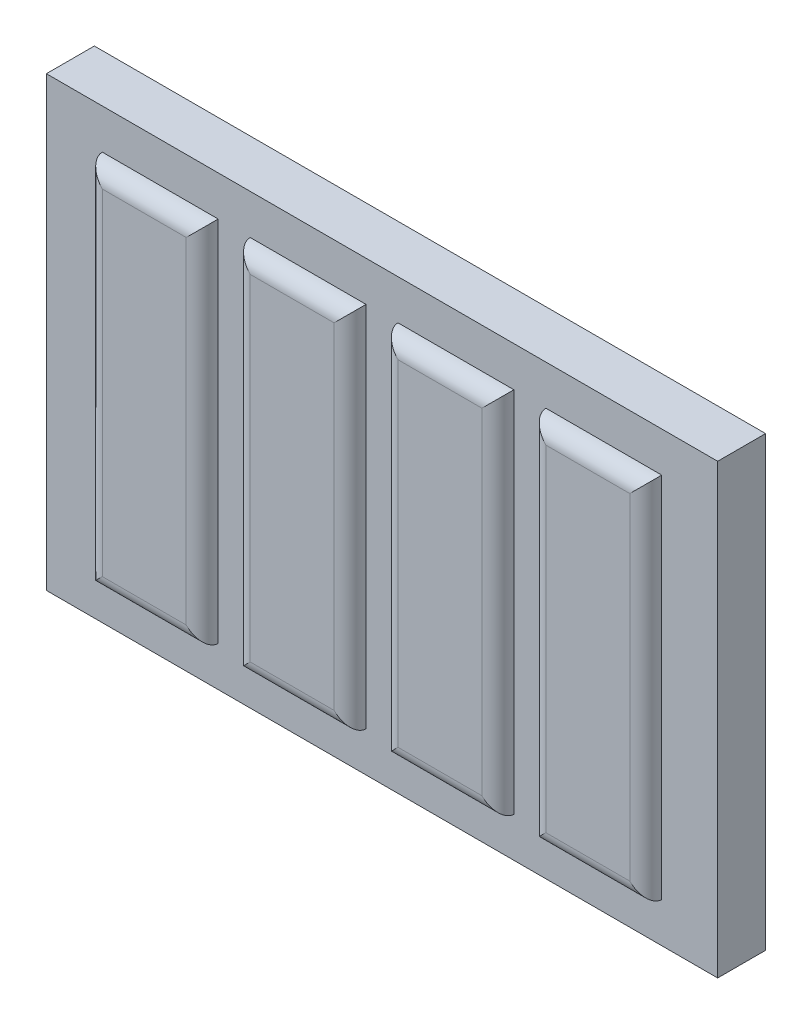
from build123d import *

# Parameters (mm, degrees)
SKETCH1_W           = 10.668
SKETCH1_H           = 7.112
BOSS_EXTRUDE1_DEPTH = 0.762
SKETCH2_W           = 1.8415
SKETCH2_H           = 5.842
BOSS_EXTRUDE2_DEPTH = 0.254
FILLET1_R           = 0.254


with BuildPart() as part:
    # Sketch1 → Boss-Extrude1 (new body)
    with BuildSketch(Plane.XY):
        with Locations((5.334, 3.556)):
            Rectangle(SKETCH1_W, SKETCH1_H)
    extrude(amount=BOSS_EXTRUDE1_DEPTH)

    # Sketch2 → Boss-Extrude2 (add)
    with BuildSketch(Plane.XY.offset(0.762)):
        with Locations((8.85825, 3.556)):
            Rectangle(SKETCH2_W, SKETCH2_H)
        with Locations((1.80975, 3.556)):
            Rectangle(SKETCH2_W, SKETCH2_H)
        with Locations((4.15925, 3.556)):
            Rectangle(SKETCH2_W, SKETCH2_H)
        with Locations((6.50875, 3.556)):
            Rectangle(SKETCH2_W, SKETCH2_H)
    extrude(amount=BOSS_EXTRUDE2_DEPTH)

    # Fillet1
    fillet1_edges = [part.edges().sort_by_distance(p)[0] for p in [
        (2.7305, 3.556, 1.016),
        (1.80975, 0.635, 1.016),
        (0.889, 3.556, 1.016),
        (1.80975, 6.477, 1.016),
        (5.08, 3.556, 1.016),
        (4.15925, 0.635, 1.016),
        (3.2385, 3.556, 1.016),
        (4.15925, 6.477, 1.016),
        (9.779, 3.556, 1.016),
        (8.85825, 0.635, 1.016),
        (7.9375, 3.556, 1.016),
        (8.85825, 6.477, 1.016),
        (7.4295, 3.556, 1.016),
        (6.50875, 0.635, 1.016),
        (5.588, 3.556, 1.016),
        (6.50875, 6.477, 1.016),
    ]]
    fillet(fillet1_edges, radius=FILLET1_R - 0.0001)  # a hair under: the kernel refuses the full size


solid = part.part
